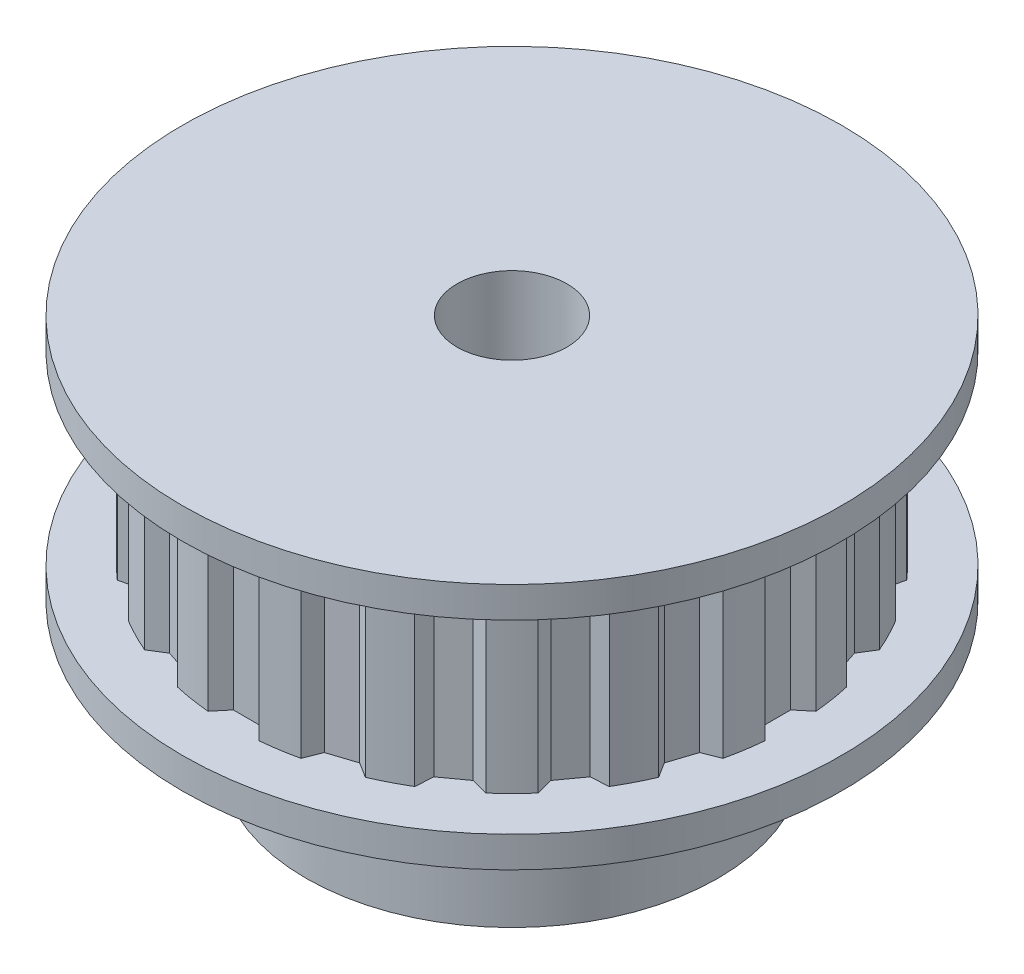
from build123d import *

# Parameters (mm, degrees)
SKETCH1_R               = 19.05
SKETCH1_R_2             = 3.175
BOSS_EXTRUDE1_DEPTH     = 14.2875
SKETCH5_R               = 20.220487724
SKETCH5_R_2             = 16.1671
CUT_EXTRUDE2_DEPTH      = 5.3594
CUT_EXTRUDE1_DEPTH      = 5.3594
CIRPATTERN1_COUNT       = 20
BOSS_EXTRUDE2_START     = 7.9375
SKETCH6_R               = 11.90625
SKETCH6_R_2             = 3.175
BOSS_EXTRUDE2_DEPTH     = 7.9375
CUT_EXTRUDE3_DEPTH      = 31.494879181
CUT_EXTRUDE3_DEPTH_BACK = 31.494879181
SKETCH7_R               = 0.8255


with BuildPart() as part:
    # Sketch1 → Boss-Extrude1 (new body)
    with BuildSketch(Plane(origin=(0, 0, 0), x_dir=(1, 0, 0), z_dir=(0, 1, 0))):
        Circle(SKETCH1_R)
        Circle(SKETCH1_R_2, mode=Mode.SUBTRACT)
    extrude(amount=BOSS_EXTRUDE1_DEPTH)

    # Sketch5 → Cut-Extrude2 (cut, symmetric)
    with BuildSketch(Plane(origin=(0, 7.14375, 0), x_dir=(-1, 0, 0), z_dir=(0, 1, 0))):
        Circle(SKETCH5_R)
        Circle(SKETCH5_R_2, mode=Mode.SUBTRACT)
    extrude(amount=CUT_EXTRUDE2_DEPTH, both=True, mode=Mode.SUBTRACT)

    # Sketch3 → Cut-Extrude1 (cut, symmetric)
    with BuildSketch(Plane(origin=(0, 7.14375, 0), x_dir=(-1, 0, 0), z_dir=(0, 1, 0))):
        Polygon((-2.610122287, 17.462762559), (2.610122287, 17.462762559), (0.81011866, 15.300310945), (-0.81011866, 15.300310945), align=None)
    cut_extrude1 = extrude(amount=CUT_EXTRUDE1_DEPTH, both=True, mode=Mode.SUBTRACT)

    # CirPattern1: Cut-Extrude1 ×20 about axis
    cirpattern1_axis = Axis((0, 14.2875, 0), (0, 1, 0))
    for i in range(1, CIRPATTERN1_COUNT):
        add(cut_extrude1.rotate(cirpattern1_axis, i * 360 / CIRPATTERN1_COUNT), mode=Mode.SUBTRACT)

    # Sketch6 → Boss-Extrude2 (add)
    with BuildSketch(Plane.XZ.offset(BOSS_EXTRUDE2_START)):
        Circle(SKETCH6_R)
        Circle(SKETCH6_R_2, mode=Mode.SUBTRACT)
    extrude(amount=-BOSS_EXTRUDE2_DEPTH)

    # Sketch7 → Cut-Extrude3 (cut, two sides: drawn at the far end of the back side and taken through both)
    with BuildSketch(Plane.XY.offset(-CUT_EXTRUDE3_DEPTH_BACK)):
        with Locations((0, -3.866771019)):
            Circle(SKETCH7_R)
    extrude(amount=CUT_EXTRUDE3_DEPTH + CUT_EXTRUDE3_DEPTH_BACK, mode=Mode.SUBTRACT)


solid = part.part
